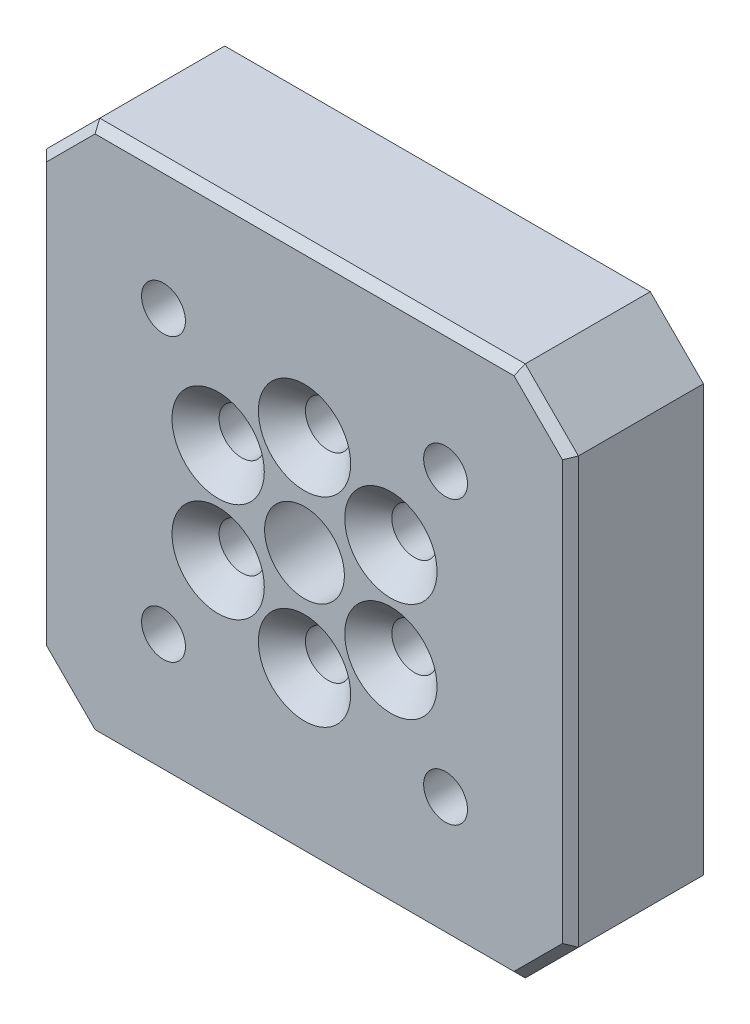
from build123d import *

# Parameters (mm, degrees)
SKETCH1_W                                            = 40
SKETCH1_H                                            = 40
BOSS_EXTRUDE1_DEPTH                                  = 10
F_6_0MM_DOWEL_HOLE1_D                                = 6
CSK_FOR_M3_HEX_SOCKET_COUNTERSUNK_HEAD_S_D           = 3.4
CSK_FOR_M3_HEX_SOCKET_COUNTERSUNK_HEAD_S_CSINK_D     = 6.94
CSK_FOR_M3_HEX_SOCKET_COUNTERSUNK_HEAD_S_CSINK_ANGLE = 90
TAP_DRILL_FOR_M4_TAP1_D                              = 3.3
CHAMFER1_SIZE                                        = 4
CHAMFER2_SIZE                                        = 0.6


with BuildPart() as part:
    # Sketch1 → Boss-Extrude1 (new body)
    with BuildSketch(Plane.XY):
        with Locations((20, 20)):
            Rectangle(SKETCH1_W, SKETCH1_H)
    extrude(amount=BOSS_EXTRUDE1_DEPTH)

    # Ø6.0mm Dowel Hole1 (through all)
    with Locations(Plane.XY.offset(10)):
        with Locations((20, 20)):
            Hole(F_6_0MM_DOWEL_HOLE1_D / 2)

    # CSK for M3 Hex Socket Countersunk Head Screw1 (through all)
    with Locations(Plane.XY.offset(10)):
        with Locations((20, 27.5), (26.495190528, 23.75), (26.495190528, 16.25), (20, 12.5), (13.504809472, 16.25), (13.504809472, 23.75)):
            CounterSinkHole(CSK_FOR_M3_HEX_SOCKET_COUNTERSUNK_HEAD_S_D / 2, CSK_FOR_M3_HEX_SOCKET_COUNTERSUNK_HEAD_S_CSINK_D / 2, counter_sink_angle=CSK_FOR_M3_HEX_SOCKET_COUNTERSUNK_HEAD_S_CSINK_ANGLE)

    # Tap Drill for M4 Tap1 (through all)
    with Locations(Plane.XY.offset(10)):
        with Locations((9.393398282, 30.606601718), (30.606601718, 30.606601718), (30.606601718, 9.393398282), (9.393398282, 9.393398282)):
            Hole(TAP_DRILL_FOR_M4_TAP1_D / 2)

    # Chamfer1
    chamfer1_edges = [part.edges().sort_by_distance(p)[0] for p in [
        (40, 0, 5),
        (40, 40, 5),
        (0, 0, 5),
        (0, 40, 5),
    ]]
    chamfer(chamfer1_edges, length=CHAMFER1_SIZE)

    # Chamfer2
    chamfer2_edges = [part.edges().sort_by_distance(p)[0] for p in [
        (40, 20, 10),
        (38, 38, 10),
        (38, 2, 10),
        (20, 0, 10),
        (2, 2, 10),
        (0, 20, 10),
        (2, 38, 10),
        (20, 40, 10),
    ]]
    chamfer(chamfer2_edges, length=CHAMFER2_SIZE)


solid = part.part
